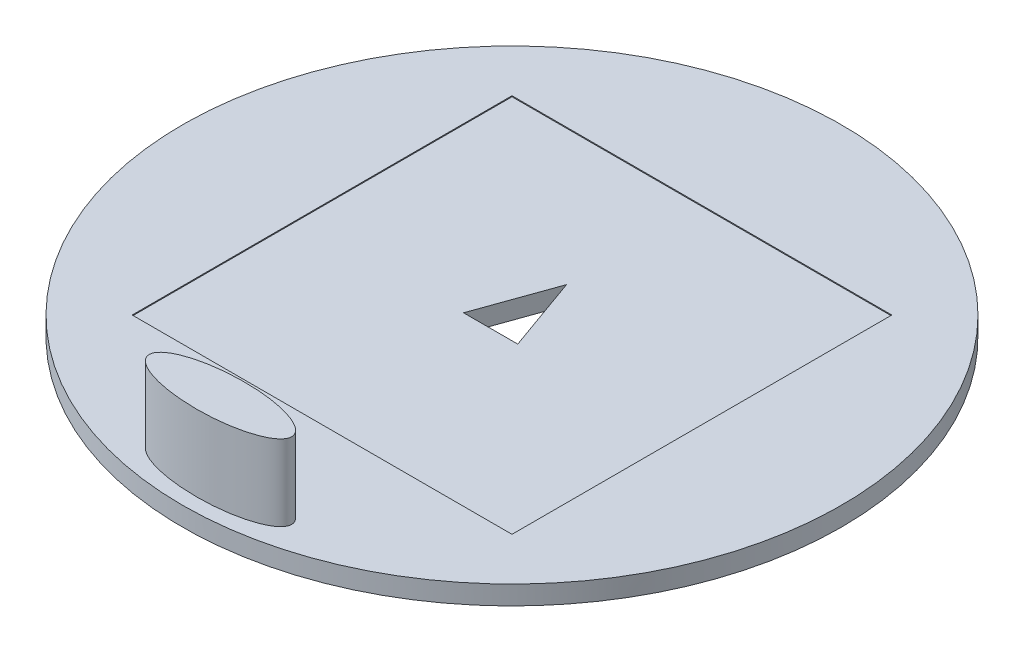
from build123d import *

# Parameters (mm, degrees)
SKETCH1_R               = 34.7
BOSS_EXTRUDE1_DEPTH     = 2
CUT_EXTRUDE1_DEPTH      = 4
SKETCH3_RX              = 7.5
SKETCH3_RY              = 2.5
BOSS_EXTRUDE2_DEPTH     = 8
SKETCH4_W               = 40
SKETCH4_H               = 40
CUT_EXTRUDE3_DEPTH      = 0.1
CUT_EXTRUDE4_DEPTH      = 22
CUT_EXTRUDE4_DEPTH_BACK = 21


with BuildPart() as part:
    # Sketch1 → Boss-Extrude1 (new body)
    with BuildSketch(Plane(origin=(0, 0, 0), x_dir=(1, 0, 0), z_dir=(0, 1, 0))):
        Circle(SKETCH1_R)
    extrude(amount=BOSS_EXTRUDE1_DEPTH)

    # Sketch1<4> → Cut-Extrude1 (cut)
    with BuildSketch(Plane(origin=(0, 0, 0), x_dir=(1, 0, 0), z_dir=(0, 1, 0))):
        Polygon((2.854751228, -2.25), (0, 5.743303437), (-2.854751228, -2.25), align=None)
    extrude(amount=CUT_EXTRUDE1_DEPTH, mode=Mode.SUBTRACT)

    # Sketch3 → Boss-Extrude2 (add)
    with BuildSketch(Plane(origin=(0, 2, 0), x_dir=(1, 0, 0), z_dir=(0, 1, 0))):
        with Locations((0, -30.694699658)):
            Ellipse(SKETCH3_RX, SKETCH3_RY)
    extrude(amount=BOSS_EXTRUDE2_DEPTH)

    # Sketch4 → Cut-Extrude3 (cut)
    with BuildSketch(Plane(origin=(0, 2, 0), x_dir=(1, 0, 0), z_dir=(0, 1, 0))):
        Rectangle(SKETCH4_W, SKETCH4_H)
    extrude(amount=-CUT_EXTRUDE3_DEPTH, mode=Mode.SUBTRACT)

    # Sketch7 → Cut-Extrude4 (cut, two sides: drawn at the far end of the back side and taken through both)
    with BuildSketch(Plane.XY.offset(-CUT_EXTRUDE4_DEPTH_BACK)):
        Polygon((-34.7, 1), (-29.75, 0), (-34.7, 0), align=None)
    extrude(amount=CUT_EXTRUDE4_DEPTH + CUT_EXTRUDE4_DEPTH_BACK, mode=Mode.SUBTRACT)


solid = part.part
